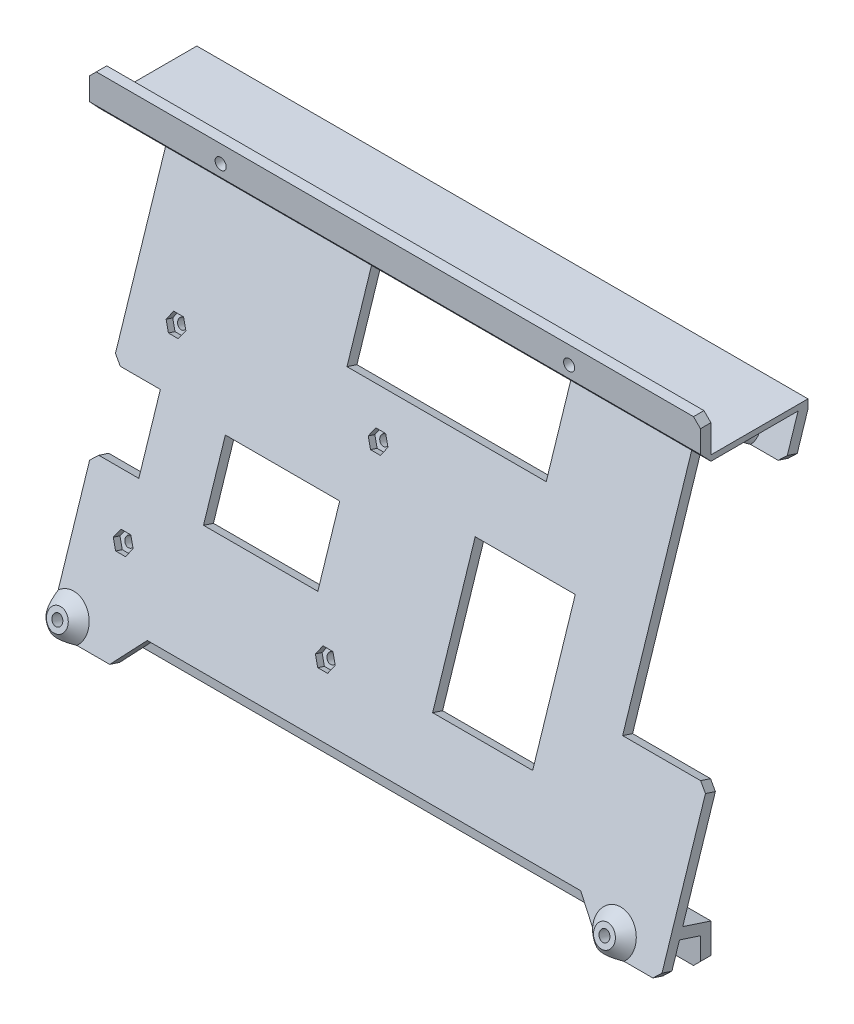
from build123d import *

# Parameters (mm, degrees)
CROQUIS2_W                = 175.366568914
CROQUIS2_H                = 8.4
SALIENTE_EXTRUIR2_DEPTH   = 3
SALIENTE_EXTRUIR2_2_DEPTH = 3
CROQUIS7_R                = 1.6
CORTAR_EXTRUIR3_DEPTH     = 112.124247459
SALIENTE_EXTRUIR3_DEPTH   = 175.366568915
CROQUIS9_R                = 1.5
CORTAR_EXTRUIR4_DEPTH     = 10
SALIENTE_EXTRUIR4_START   = 3
CROQUIS10_R               = 3
CROQUIS10_R_2             = 1.5
SALIENTE_EXTRUIR4_DEPTH   = 3
CORTAR_EXTRUIR5_REACH     = 116.634
CROQUIS11_W               = 24.383284457
CROQUIS11_H               = 72
CROQUIS11_W_2             = 57.167783698
CROQUIS11_H_2             = 42.619666177
CROQUIS11_W_3             = 28.708880417
CROQUIS11_H_3             = 39.557025544
CROQUIS11_W_4             = 32.810149048
CROQUIS11_H_4             = 20.301279723
CORTAR_EXTRUIR6_REACH     = 116.634
CROQUIS13_R               = 1.375
CROQUIS15_R               = 3
CROQUIS15_R_2             = 1.375
SALIENTE_EXTRUIR5_DEPTH   = 3
CROQUIS16_W               = 13.5
CROQUIS16_H               = 20
CORTAR_EXTRUIR8_DEPTH     = 3
CORTAR_EXTRUIR9_DEPTH     = 2
CHAFL_N1_SIZE             = 2
CHAFL_N2_SIZE             = 3
CORTAR_EXTRUIR10_DEPTH    = 2.5
CHAFL_N3_SIZE             = 2


with BuildPart() as part:
    # Croquis2 → Saliente-Extruir2 (new body)
    with BuildSketch(Plane.XY):
        with Locations((0, 64)):
            Rectangle(CROQUIS2_W, CROQUIS2_H)
    extrude(amount=SALIENTE_EXTRUIR2_DEPTH)


with BuildPart() as body_2:
    # Croquis2 → Saliente-Extruir2 2 (new body)
    with BuildSketch(Plane.XY):
        with Locations((0, -64)):
            Rectangle(CROQUIS2_W, CROQUIS2_H)
    extrude(amount=SALIENTE_EXTRUIR2_2_DEPTH)


with BuildPart() as cortar_extruir3_tool:
    # Croquis7 → Cortar-Extruir3 (new, through all)
    with BuildSketch(Plane.XY.offset(3)):
        with Locations((50, 63.2)):
            Circle(CROQUIS7_R)
        with Locations(Location((-50, 63.2, 0), (0, 0, 180))):
            Circle(CROQUIS7_R)
        with Locations(Location((50, -63.2, 0), (0, 0, 180))):
            Circle(CROQUIS7_R)
        with Locations((-50, -63.2)):
            Circle(CROQUIS7_R)
    extrude(amount=-CORTAR_EXTRUIR3_DEPTH)


with BuildPart() as part_1:
    add(part.part)

    # Cortar-Extruir3: cut by cortar_extruir3_tool
    add(cortar_extruir3_tool.part, mode=Mode.SUBTRACT)



with BuildPart() as body_2_1:
    add(body_2.part)

    # Cortar-Extruir3: cut by cortar_extruir3_tool
    add(cortar_extruir3_tool.part, mode=Mode.SUBTRACT)


with BuildPart() as part_2:
    add(part_1.part)

    add(body_2_1.part)  # Saliente-Extruir3 merges body 2
    # Croquis8 → Saliente-Extruir3 (add)
    with BuildSketch(Plane(origin=(87.683284457, 0, 0), x_dir=(0, 0, -1), z_dir=(1, 0, 0))):
        Polygon((-8.099231702, -54.988772512), (0, -57.620372416), (0, -59.8), (-3, -59.8), (-9.026282685, -57.84194206), (-11.807435635, -66.401450707), (-14.660605184, -65.474399724), (-11.879452234, -56.914891077), (25.003771692, 56.6), (0, 56.6), (-3, 59.8), (0, 59.8), (0, 58.2), (27.85017215, 58.2), (27.85017215, 55.652115897), align=None)
    extrude(amount=-SALIENTE_EXTRUIR3_DEPTH)

    # Croquis9 → Cortar-Extruir4 (cut)
    with BuildSketch(Plane(origin=(0, -1.943605067, -5.981801318), x_dir=(1, 0, 0), z_dir=(0, 0.30901699437494135, 0.9510565162951556))):
        with Locations(Location((-83.7, 53.556389199, 0), (0, 0, 270))):
            Circle(CROQUIS9_R)
        with Locations(Location((73.3, 53.556389199, 0), (0, 0, 270))):
            Circle(CROQUIS9_R)
        with Locations(Location((-83.7, -62.443610801, 0), (0, 0, 270))):
            Circle(CROQUIS9_R)
        with Locations(Location((73.3, -62.443610801, 0), (0, 0, 270))):
            Circle(CROQUIS9_R)
    extrude(amount=-CORTAR_EXTRUIR4_DEPTH, mode=Mode.SUBTRACT)

    # Croquis10 → Saliente-Extruir4 (add)
    # profile 1 of 4: a face of its own
    with BuildSketch(Plane(origin=(0, -1.943605067, -5.981801318), x_dir=(1, 0, 0), z_dir=(0, 0.30901699437494135, 0.9510565162951556)).offset(SALIENTE_EXTRUIR4_START)):
        with Locations(Location((-83.7, 53.556389199, 0), (0, 0, 90))):
            Circle(CROQUIS10_R)
        with Locations(Location((-83.7, 53.556389199, 0), (0, 0, 270))):
            Circle(CROQUIS10_R_2, mode=Mode.SUBTRACT)
    # profile 2 of 4: a face of its own
    with BuildSketch(Plane(origin=(0, -1.943605067, -5.981801318), x_dir=(1, 0, 0), z_dir=(0, 0.30901699437494135, 0.9510565162951556)).offset(SALIENTE_EXTRUIR4_START)):
        with Locations(Location((73.3, 53.556389199, 0), (0, 0, 90))):
            Circle(CROQUIS10_R)
        with Locations(Location((73.3, 53.556389199, 0), (0, 0, 270))):
            Circle(CROQUIS10_R_2, mode=Mode.SUBTRACT)
    # profile 3 of 4: a face of its own
    with BuildSketch(Plane(origin=(0, -1.943605067, -5.981801318), x_dir=(1, 0, 0), z_dir=(0, 0.30901699437494135, 0.9510565162951556)).offset(SALIENTE_EXTRUIR4_START)):
        with Locations(Location((73.3, -62.443610801, 0), (0, 0, 90))):
            Circle(CROQUIS10_R)
        with Locations(Location((73.3, -62.443610801, 0), (0, 0, 270))):
            Circle(CROQUIS10_R_2, mode=Mode.SUBTRACT)
    # profile 4 of 4: a face of its own
    with BuildSketch(Plane(origin=(0, -1.943605067, -5.981801318), x_dir=(1, 0, 0), z_dir=(0, 0.30901699437494135, 0.9510565162951556)).offset(SALIENTE_EXTRUIR4_START)):
        with Locations(Location((-83.7, -62.443610801, 0), (0, 0, 90))):
            Circle(CROQUIS10_R)
        with Locations(Location((-83.7, -62.443610801, 0), (0, 0, 270))):
            Circle(CROQUIS10_R_2, mode=Mode.SUBTRACT)
    extrude(amount=-SALIENTE_EXTRUIR4_DEPTH)

    # Croquis11 → Cortar-Extruir5 (cut, up to next)
    with BuildSketch(Plane(origin=(0, -1.943605067, -5.981801318), x_dir=(1, 0, 0), z_dir=(0, 0.3090169943749416, 0.9510565162951555)), mode=Mode.PRIVATE) as cortar_extruir5_sk1:
        with Locations((75.491642228, 13.556389199)):
            Rectangle(CROQUIS11_W, CROQUIS11_H)
    cortar_extruir5_tool1 = extrude(cortar_extruir5_sk1.sketch, amount=-CORTAR_EXTRUIR5_REACH, mode=Mode.PRIVATE) & part_2.part
    # Croquis11 → Cortar-Extruir5 (cut, up to next)
    with BuildSketch(Plane(origin=(0, -1.943605067, -5.981801318), x_dir=(1, 0, 0), z_dir=(0, 0.3090169943749416, 0.9510565162951555)), mode=Mode.PRIVATE) as cortar_extruir5_sk2:
        Polygon((-62.179017321, -57.800230658), (62.179017321, -57.800230658), (70.176985986, -66.800230658), (-70.176985986, -66.800230658), align=None)
    cortar_extruir5_tool2 = extrude(cortar_extruir5_sk2.sketch, amount=-CORTAR_EXTRUIR5_REACH, mode=Mode.PRIVATE) & part_2.part
    # Croquis11 → Cortar-Extruir5 (cut, up to next)
    with BuildSketch(Plane(origin=(0, -1.943605067, -5.981801318), x_dir=(1, 0, 0), z_dir=(0, 0.3090169943749416, 0.9510565162951555)), mode=Mode.PRIVATE) as cortar_extruir5_sk3:
        with Locations((0, 40.246556111)):
            Rectangle(CROQUIS11_W_2, CROQUIS11_H_2)
    cortar_extruir5_tool3 = extrude(cortar_extruir5_sk3.sketch, amount=-CORTAR_EXTRUIR5_REACH, mode=Mode.PRIVATE) & part_2.part
    # Croquis11 → Cortar-Extruir5 (cut, up to next)
    with BuildSketch(Plane(origin=(0, -1.943605067, -5.981801318), x_dir=(1, 0, 0), z_dir=(0, 0.3090169943749416, 0.9510565162951555)), mode=Mode.PRIVATE) as cortar_extruir5_sk4:
        with Locations((28.41937878, -19.778512772)):
            Rectangle(CROQUIS11_W_3, CROQUIS11_H_3)
    cortar_extruir5_tool4 = extrude(cortar_extruir5_sk4.sketch, amount=-CORTAR_EXTRUIR5_REACH, mode=Mode.PRIVATE) & part_2.part
    # Croquis11 → Cortar-Extruir5 (cut, up to next)
    with BuildSketch(Plane(origin=(0, -1.943605067, -5.981801318), x_dir=(1, 0, 0), z_dir=(0, 0.3090169943749416, 0.9510565162951555)), mode=Mode.PRIVATE) as cortar_extruir5_sk5:
        with Locations((-38.636363337, -18.538023811)):
            Rectangle(CROQUIS11_W_4, CROQUIS11_H_4)
    cortar_extruir5_tool5 = extrude(cortar_extruir5_sk5.sketch, amount=-CORTAR_EXTRUIR5_REACH, mode=Mode.PRIVATE) & part_2.part
    add(cortar_extruir5_tool1.solids().sort_by_distance((75.491642, 10.949287, -10.170956))[0], mode=Mode.SUBTRACT)
    add(cortar_extruir5_tool2.solids().sort_by_distance((0, -61.280851, 13.298038))[0], mode=Mode.SUBTRACT)
    add(cortar_extruir5_tool3.solids().sort_by_distance((0, 36.333144, -18.418671))[0], mode=Mode.SUBTRACT)
    add(cortar_extruir5_tool4.solids().sort_by_distance((28.419379, -20.754089, 0.130095))[0], mode=Mode.SUBTRACT)
    add(cortar_extruir5_tool5.solids().sort_by_distance((-38.636363, -19.574313, -0.253237))[0], mode=Mode.SUBTRACT)

    # Croquis13 → Cortar-Extruir6 (cut, up to next)
    with BuildSketch(Plane(origin=(0, -1.943605067, -5.981801318), x_dir=(1, 0, 0), z_dir=(0, 0.30901699437494223, 0.9510565162951553)), mode=Mode.PRIVATE) as cortar_extruir6_sk1:
        with Locations(Location((-74.183284457, 7.699769342, 0), (0, 0, 270))):
            Circle(CROQUIS13_R)
    cortar_extruir6_tool1 = extrude(cortar_extruir6_sk1.sketch, amount=-CORTAR_EXTRUIR6_REACH, mode=Mode.PRIVATE) & part_2.part
    # Croquis13 → Cortar-Extruir6 (cut, up to next)
    with BuildSketch(Plane(origin=(0, -1.943605067, -5.981801318), x_dir=(1, 0, 0), z_dir=(0, 0.30901699437494223, 0.9510565162951553)), mode=Mode.PRIVATE) as cortar_extruir6_sk2:
        with Locations(Location((-16.183284457, 7.699769342, 0), (0, 0, 270))):
            Circle(CROQUIS13_R)
    cortar_extruir6_tool2 = extrude(cortar_extruir6_sk2.sketch, amount=-CORTAR_EXTRUIR6_REACH, mode=Mode.PRIVATE) & part_2.part
    # Croquis13 → Cortar-Extruir6 (cut, up to next)
    with BuildSketch(Plane(origin=(0, -1.943605067, -5.981801318), x_dir=(1, 0, 0), z_dir=(0, 0.30901699437494223, 0.9510565162951553)), mode=Mode.PRIVATE) as cortar_extruir6_sk3:
        with Locations(Location((-74.183284457, -41.300230658, 0), (0, 0, 270))):
            Circle(CROQUIS13_R)
    cortar_extruir6_tool3 = extrude(cortar_extruir6_sk3.sketch, amount=-CORTAR_EXTRUIR6_REACH, mode=Mode.PRIVATE) & part_2.part
    # Croquis13 → Cortar-Extruir6 (cut, up to next)
    with BuildSketch(Plane(origin=(0, -1.943605067, -5.981801318), x_dir=(1, 0, 0), z_dir=(0, 0.30901699437494223, 0.9510565162951553)), mode=Mode.PRIVATE) as cortar_extruir6_sk4:
        with Locations(Location((-16.183284457, -41.300230658, 0), (0, 0, 270))):
            Circle(CROQUIS13_R)
    cortar_extruir6_tool4 = extrude(cortar_extruir6_sk4.sketch, amount=-CORTAR_EXTRUIR6_REACH, mode=Mode.PRIVATE) & part_2.part
    add(cortar_extruir6_tool1.solids().sort_by_distance((-74.183284, 5.379311, -8.361161))[0], mode=Mode.SUBTRACT)
    add(cortar_extruir6_tool2.solids().sort_by_distance((-16.183284, 5.379311, -8.361161))[0], mode=Mode.SUBTRACT)
    add(cortar_extruir6_tool3.solids().sort_by_distance((-74.183284, -41.222459, 6.780672))[0], mode=Mode.SUBTRACT)
    add(cortar_extruir6_tool4.solids().sort_by_distance((-16.183284, -41.222459, 6.780672))[0], mode=Mode.SUBTRACT)

    # Croquis15 → Saliente-Extruir5 (add)
    # profile 1 of 4: a face of its own
    with BuildSketch(Plane(origin=(0, -2.87065605, -8.834970867), x_dir=(-1, 0, 0), z_dir=(0, -0.3090169943749411, -0.9510565162951556))):
        with Locations(Location((16.183284457, 7.699769342, 0), (0, 0, 270))):
            Circle(CROQUIS15_R)
        with Locations(Location((16.183284457, 7.699769342, 0), (0, 0, 270))):
            Circle(CROQUIS15_R_2, mode=Mode.SUBTRACT)
    # profile 2 of 4: a face of its own
    with BuildSketch(Plane(origin=(0, -2.87065605, -8.834970867), x_dir=(-1, 0, 0), z_dir=(0, -0.3090169943749411, -0.9510565162951556))):
        with Locations(Location((74.183284457, 7.699769342, 0), (0, 0, 270))):
            Circle(CROQUIS15_R)
        with Locations(Location((74.183284457, 7.699769342, 0), (0, 0, 270))):
            Circle(CROQUIS15_R_2, mode=Mode.SUBTRACT)
    # profile 3 of 4: a face of its own
    with BuildSketch(Plane(origin=(0, -2.87065605, -8.834970867), x_dir=(-1, 0, 0), z_dir=(0, -0.3090169943749411, -0.9510565162951556))):
        with Locations(Location((74.183284457, -41.300230658, 0), (0, 0, 270))):
            Circle(CROQUIS15_R)
        with Locations(Location((74.183284457, -41.300230658, 0), (0, 0, 270))):
            Circle(CROQUIS15_R_2, mode=Mode.SUBTRACT)
    # profile 4 of 4: a face of its own
    with BuildSketch(Plane(origin=(0, -2.87065605, -8.834970867), x_dir=(-1, 0, 0), z_dir=(0, -0.3090169943749411, -0.9510565162951556))):
        with Locations(Location((16.183284457, -41.300230658, 0), (0, 0, 270))):
            Circle(CROQUIS15_R)
        with Locations(Location((16.183284457, -41.300230658, 0), (0, 0, 270))):
            Circle(CROQUIS15_R_2, mode=Mode.SUBTRACT)
    extrude(amount=SALIENTE_EXTRUIR5_DEPTH)

    # Croquis16 → Cortar-Extruir8 (cut)
    with BuildSketch(Plane(origin=(0, -2.87065605, -8.834970867), x_dir=(-1, 0, 0), z_dir=(0, -0.3090169943749411, -0.9510565162951556))):
        with Locations((80.933284457, -16.800230658)):
            Rectangle(CROQUIS16_W, CROQUIS16_H)
    extrude(amount=-CORTAR_EXTRUIR8_DEPTH, mode=Mode.SUBTRACT)

    # Croquis17 → Cortar-Extruir9 (cut)
    with BuildSketch(Plane(origin=(0, -1.943605067, -5.981801318), x_dir=(1, 0, 0), z_dir=(0, 0.30901699437494223, 0.9510565162951553))):
        Polygon((-71.342721133, 7.699769342), (-72.763002795, 10.159769342), (-75.60356612, 10.159769342), (-77.023847782, 7.699769342), (-75.60356612, 5.239769342), (-72.763002795, 5.239769342), align=None)
        Polygon((-13.342721133, 7.699769342), (-14.763002795, 10.159769342), (-17.60356612, 10.159769342), (-19.023847782, 7.699769342), (-17.60356612, 5.239769342), (-14.763002795, 5.239769342), align=None)
        Polygon((-13.342721133, -41.300230658), (-14.763002795, -38.840230658), (-17.60356612, -38.840230658), (-19.023847782, -41.300230658), (-17.60356612, -43.760230658), (-14.763002795, -43.760230658), align=None)
        Polygon((-71.342721133, -41.300230658), (-72.763002795, -38.840230658), (-75.60356612, -38.840230658), (-77.023847782, -41.300230658), (-75.60356612, -43.760230658), (-72.763002795, -43.760230658), align=None)
    extrude(amount=-CORTAR_EXTRUIR9_DEPTH, mode=Mode.SUBTRACT)

    # Chaflán1
    chafl_n1_edges = [part_2.edges().sort_by_distance(p)[0] for p in [
        (-16.183284457, 7.305429306, -12.141381429),
        (-74.183284457, 7.305429306, -12.141381429),
        (-74.183284457, -39.296339993, 3.000451295),
        (-16.183284457, -39.296339993, 3.000451295),
    ]]
    chamfer(chafl_n1_edges, length=CHAFL_N1_SIZE)

    # Chaflán2
    # the kernel refuses this chamfer: 3 mm, written as the material it adds along each edge
    with BuildSketch(Plane(origin=(73.3, -61.331008021, 13.31433561), x_dir=(0, 0.9510565162951558, -0.30901699437494096), z_dir=(1, 0, 0))) as chafl_n2_piece_1_section:
        Polygon((3 + CHAFL_N2_SIZE, 0), (3, CHAFL_N2_SIZE), (3, 0), align=None)
    chafl_n2_piece_1 = revolve(axis=Axis((73.3, -61.331008021, 13.31433561), (0, 0.30901699437494135, 0.9510565162951556)), mode=Mode.PRIVATE)
    chafl_n2_piece_1 = split(chafl_n2_piece_1, bisect_by=Plane(origin=(68.505491094, -65.352399611, 15.036082923), z_dir=(0, 0.9510565162951566, -0.309016994374938)), keep=Keep.TOP, mode=Mode.PRIVATE)
    chafl_n2_piece_1 = split(chafl_n2_piece_1, bisect_by=Plane(origin=(65.901740086, -60.776987305, 13.549441347), z_dir=(0.7474930870336779, 0.6317579197395359, -0.20527059137449855)), keep=Keep.TOP, mode=Mode.PRIVATE)
    chafl_n2_piece_1 = split(chafl_n2_piece_1, bisect_by=Plane(origin=(68.505491094, -57.771327026, 15.312111815), z_dir=(0, -0.30901699437494135, -0.9510565162951556)), keep=Keep.TOP, mode=Mode.PRIVATE)
    add(chafl_n2_piece_1)
    with BuildSketch(Plane(origin=(-83.7, -61.331008021, 13.31433561), x_dir=(0, 0.9510565162951558, -0.30901699437494096), z_dir=(1, 0, 0))) as chafl_n2_piece_2_section:
        Polygon((3 + CHAFL_N2_SIZE, 0), (3, CHAFL_N2_SIZE), (3, 0), align=None)
    chafl_n2_piece_2 = revolve(axis=Axis((-83.7, -61.331008021, 13.31433561), (0, 0.30901699437494135, 0.9510565162951556)), mode=Mode.PRIVATE)
    chafl_n2_piece_2 = split(chafl_n2_piece_2, bisect_by=Plane(origin=(-87.604867767, -65.034328592, 16.015004862), z_dir=(0, 0.9510565162951566, -0.309016994374938)), keep=Keep.TOP, mode=Mode.PRIVATE)
    chafl_n2_piece_2 = split(chafl_n2_piece_2, bisect_by=Plane(origin=(-87.683284457, -58.746802364, 13.97206375), z_dir=(1, 0, 0)), keep=Keep.TOP, mode=Mode.PRIVATE)
    chafl_n2_piece_2 = split(chafl_n2_piece_2, bisect_by=Plane(origin=(-87.604867767, -58.259822513, 15.470833621), z_dir=(0, -0.30901699437494135, -0.9510565162951556)), keep=Keep.TOP, mode=Mode.PRIVATE)
    add(chafl_n2_piece_2)
    with BuildSketch(Plane(origin=(-83.7, 48.99154787, -22.531635737), x_dir=(0, 0.9510565162951553, -0.309016994374942), z_dir=(1, 0, 0))) as chafl_n2_piece_3_section:
        Polygon((3 + CHAFL_N2_SIZE, 0), (3, CHAFL_N2_SIZE), (3, 0), align=None)
    chafl_n2_piece_3 = revolve(axis=Axis((-83.7, 48.99154787, -22.531635737), (0, 0.30901699437494135, 0.9510565162951556)), mode=Mode.PRIVATE)
    chafl_n2_piece_3 = split(chafl_n2_piece_3, bisect_by=Plane(origin=(-87.683284457, 45.14380777, -19.784791499), z_dir=(1, 0, 0)), keep=Keep.TOP, mode=Mode.PRIVATE)
    chafl_n2_piece_3 = split(chafl_n2_piece_3, bisect_by=Plane(origin=(-83.7, 45.631007971, -18.285343462), z_dir=(0, -0.30901699437494135, -0.9510565162951556)), keep=Keep.TOP, mode=Mode.PRIVATE)
    add(chafl_n2_piece_3)
    with BuildSketch(Plane(origin=(73.3, 48.99154787, -22.531635737), x_dir=(0, 0.9510565162951558, -0.30901699437494096), z_dir=(1, 0, 0))) as chafl_n2_piece_4_section:
        Polygon((3 + CHAFL_N2_SIZE, 0), (3, CHAFL_N2_SIZE), (3, 0), align=None)
    chafl_n2_piece_4 = revolve(axis=Axis((73.3, 48.99154787, -22.531635737), (0, 0.30901699437494135, 0.9510565162951556)), mode=Mode.PRIVATE)
    chafl_n2_piece_4 = split(chafl_n2_piece_4, bisect_by=Plane(origin=(68.505247216, 45.309408938, -20.919822198), z_dir=(0, 0.9510565162951554, -0.30901699437494157)), keep=Keep.TOP, mode=Mode.PRIVATE)
    chafl_n2_piece_4 = split(chafl_n2_piece_4, bisect_by=Plane(origin=(68.505247216, 52.551362776, -20.533903043), z_dir=(0, -0.30901699437494135, -0.9510565162951556)), keep=Keep.TOP, mode=Mode.PRIVATE)
    add(chafl_n2_piece_4)

    # Croquis18 → Cortar-Extruir10 (cut)
    with BuildSketch(Plane(origin=(0, -2.87065605, -8.834970867), x_dir=(-1, 0, 0), z_dir=(0, -0.3090169943749411, -0.9510565162951556))):
        Polygon((-70.124573519, 53.556389199), (-71.71228676, 56.306389199), (-74.88771324, 56.306389199), (-76.475426481, 53.556389199), (-74.88771324, 50.806389199), (-71.71228676, 50.806389199), align=None)
        Polygon((86.45, 55.144102439), (83.7, 56.731815679), (80.95, 55.144102439), (80.95, 51.968675958), (83.7, 50.380962718), (86.45, 51.968675958), align=None)
        Polygon((86.45, -60.855897561), (83.7, -59.268184321), (80.95, -60.855897561), (80.95, -64.031324042), (83.7, -65.619037282), (86.45, -64.031324042), align=None)
        Polygon((-70.124573519, -62.443610801), (-71.71228676, -59.693610801), (-74.88771324, -59.693610801), (-76.475426481, -62.443610801), (-74.88771324, -65.193610801), (-71.71228676, -65.193610801), align=None)
    extrude(amount=-CORTAR_EXTRUIR10_DEPTH, mode=Mode.SUBTRACT)

    # Chaflán3
    chafl_n3_edges = [part_2.edges().sort_by_distance(p)[0] for p in [
        (87.683284457, 44.723796313, -22.722152534),
        (87.683284457, -23.75227286, -0.472928939),
        (-87.683284457, -8.874534238, -5.306999253),
        (-87.683284457, -27.895664564, 0.873340634),
        (87.683284457, -65.937925216, 13.234020409),
        (-87.683284458, -65.937925216, 13.234020409),
        (87.683284457, -68.2, 1.5),
        (-87.683284457, -68.2, 1.5),
        (87.683284457, 68.2, 1.5),
        (-87.683284457, 68.2, 1.5),
    ]]
    chamfer(chafl_n3_edges, length=CHAFL_N3_SIZE)


solid = part_2.part
